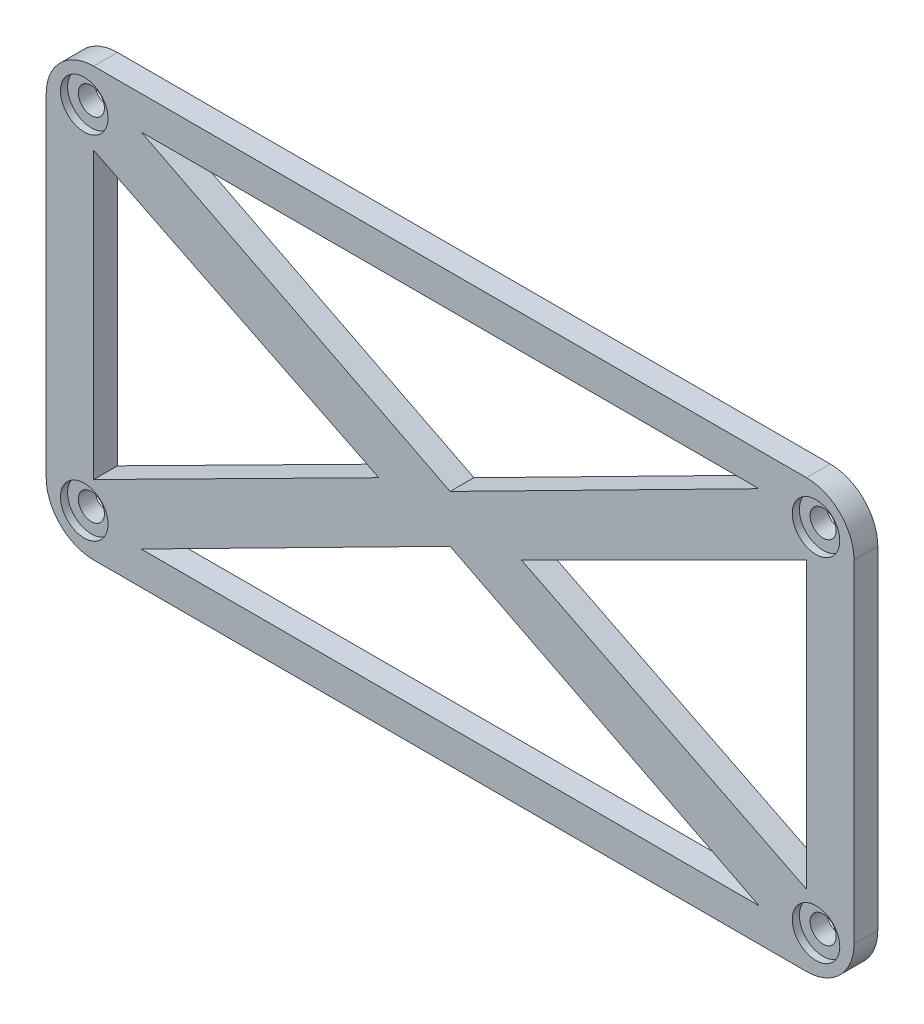
from build123d import *

# Parameters (mm, degrees)
EXTRUDE_1_DEPTH          = 5
CUT_EXTRUDE_1_DEPTH      = 39
CUT_EXTRUDE_1_DEPTH_BACK = 10
SKETCH_2_R               = 2.75
SKETCH_3_R               = 5
CUT_EXTRUDE_2_DEPTH      = 1.5


with BuildPart() as part:
    # 草图1 → 凸台-拉伸1 (new body)
    with BuildSketch(Plane.XY):
        with BuildLine():
            Line((-72.574116531, 45.487390308), (77.425883469, 45.487390308))
            ThreePointArc((77.425883469, 45.487390308), (84.496951281, 42.558458119), (87.425883469, 35.487390308))
            Line((87.425883469, 35.487390308), (87.425883469, -34.512609692))
            ThreePointArc((87.425883469, -34.512609692), (84.496951281, -41.583677504), (77.425883469, -44.512609692))
            Line((77.425883469, -44.512609692), (-72.574116531, -44.512609692))
            ThreePointArc((-72.574116531, -44.512609692), (-79.645184343, -41.583677504), (-82.574116531, -34.512609692))
            Line((-82.574116531, -34.512609692), (-82.574116531, 35.487390308))
            ThreePointArc((-82.574116531, 35.487390308), (-79.645184343, 42.558458119), (-72.574116531, 45.487390308))
        make_face()
    extrude(amount=EXTRUDE_1_DEPTH)

    # 草图2 → 切除-拉伸1 (cut, two sides: drawn at the far end of the back side and taken through both)
    with BuildSketch(Plane.XY.offset(5).offset(-CUT_EXTRUDE_1_DEPTH_BACK)):
        with Locations((-74.574116531, 37.487390308)):
            Circle(SKETCH_2_R)
        with Locations((-74.574116531, -36.512609692)):
            Circle(SKETCH_2_R)
        with Locations((79.425883469, 37.487390308)):
            Circle(SKETCH_2_R)
        with Locations((79.425883469, -36.512609692)):
            Circle(SKETCH_2_R)
        Polygon((-62.574116531, 38.487390308), (2.425883469, 5.487390308), (67.425883469, 38.487390308), align=None)
        Polygon((-72.574116531, 30.156085606), (-12.574116531, 0.487390308), (-72.574116531, -29.843914394), align=None)
        Polygon((2.425883469, -4.512609692), (-62.574116531, -37.512609692), (67.425883469, -37.512609692), align=None)
        Polygon((17.425883469, 0.487390308), (77.425883469, 30.487390308), (77.425883469, -29.512609692), align=None)
    extrude(amount=CUT_EXTRUDE_1_DEPTH + CUT_EXTRUDE_1_DEPTH_BACK, mode=Mode.SUBTRACT)

    # 草图3 → 切除-拉伸2 (cut)
    with BuildSketch(Plane.XY.offset(5)):
        with Locations((-74.574116531, 37.487390308)):
            Circle(SKETCH_3_R)
        with Locations((79.425883469, 37.487390308)):
            Circle(SKETCH_3_R)
        with Locations((79.425883469, -36.512609692)):
            Circle(SKETCH_3_R)
        with Locations((-74.574116531, -36.512609692)):
            Circle(SKETCH_3_R)
    extrude(amount=-CUT_EXTRUDE_2_DEPTH, mode=Mode.SUBTRACT)


solid = part.part
